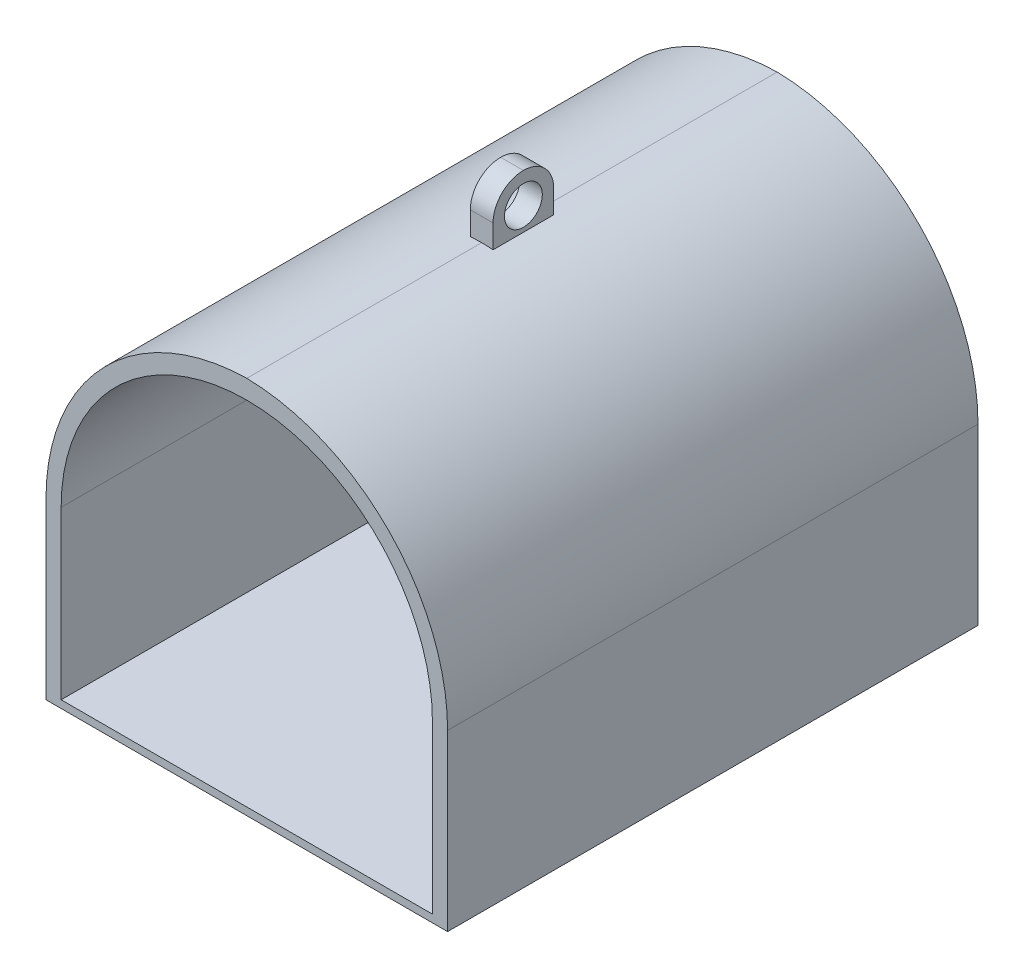
from build123d import *

# Parameters (mm, degrees)
ESQUISSE1_W             = 53
ESQUISSE1_H             = 50
BOSS_EXTRU_1_DEPTH      = 70
ESQUISSE5_W             = 3
ESQUISSE5_H             = 8
BOSS_EXTRU_2_DEPTH      = 7
CONG_1_R                = 4
CONG_2_R                = 27
ESQUISSE8_R             = 2.5
ENL_V_MAT_EXTRU_3_DEPTH = 7
ENL_V_MAT_EXTRU_4_DEPTH = 68


# Some blends are built 0.0001 mm under size
with BuildPart() as part:
    # Esquisse1 → Boss.-Extru.1 (new body)
    with BuildSketch(Plane.XY):
        with Locations((26.5, 25)):
            Rectangle(ESQUISSE1_W, ESQUISSE1_H)
    extrude(amount=BOSS_EXTRU_1_DEPTH)

    # Esquisse5 → Boss.-Extru.2 (add)
    with BuildSketch(Plane(origin=(0, 50, 0), x_dir=(1, 0, 0), z_dir=(0, 1, 0))):
        with Locations((26.5, -35)):
            Rectangle(ESQUISSE5_W, ESQUISSE5_H)
    extrude(amount=BOSS_EXTRU_2_DEPTH)

    # Congé1
    cong_1_edges = [part.edges().sort_by_distance(p)[0] for p in [
        (26.5, 57, 31),
        (26.5, 57, 39),
    ]]
    fillet(cong_1_edges, radius=CONG_1_R - 0.0001)  # a hair under: the kernel refuses the full size

    # Congé2
    # the kernel refuses this fillet: 27 mm, written as the material it takes off along each edge
    with BuildSketch(Plane(origin=(0, 50, -67.5), x_dir=(1, 0, 0), z_dir=(0, 0, 1))) as cong_2_piece_1_section:
        with BuildLine():
            CenterArc((CONG_2_R, -CONG_2_R), CONG_2_R, 90, 90)
            Line((0, -CONG_2_R), (0, 0))
            Line((0, 0), (CONG_2_R, 0))
        make_face()
    cong_2_piece_1 = extrude(amount=205, mode=Mode.PRIVATE)
    cong_2_piece_1 = split(cong_2_piece_1, bisect_by=Plane(origin=(25, 50.257211281, -18.25), z_dir=(1, 0, 0)), keep=Keep.TOP, mode=Mode.PRIVATE)
    cong_2_piece_1 = split(cong_2_piece_1, bisect_by=Plane(origin=(25.978114042, 50.257211281, 31), z_dir=(0, 0, -1)), keep=Keep.TOP, mode=Mode.PRIVATE)
    add(cong_2_piece_1, mode=Mode.SUBTRACT)
    with BuildSketch(Plane(origin=(0, 50, -67.5), x_dir=(1, 0, 0), z_dir=(0, 0, 1))) as cong_2_piece_2_section:
        with BuildLine():
            CenterArc((CONG_2_R, -CONG_2_R), CONG_2_R, 90, 90)
            Line((0, -CONG_2_R), (0, 0))
            Line((0, 0), (CONG_2_R, 0))
        make_face()
    cong_2_piece_2 = extrude(amount=205, mode=Mode.PRIVATE)
    cong_2_piece_2 = split(cong_2_piece_2, bisect_by=Plane(origin=(25, 43.848394797, -18.25), z_dir=(-1, 0, 0)), keep=Keep.TOP, mode=Mode.PRIVATE)
    cong_2_piece_2 = split(cong_2_piece_2, bisect_by=Plane(origin=(5.991236712, 43.848394797, 31), z_dir=(0, 0, -1)), keep=Keep.TOP, mode=Mode.PRIVATE)
    add(cong_2_piece_2, mode=Mode.SUBTRACT)
    with BuildSketch(Plane(origin=(0, 50, -67.5), x_dir=(1, 0, 0), z_dir=(0, 0, 1))) as cong_2_piece_3_section:
        with BuildLine():
            CenterArc((CONG_2_R, -CONG_2_R), CONG_2_R, 90, 90)
            Line((0, -CONG_2_R), (0, 0))
            Line((0, 0), (CONG_2_R, 0))
        make_face()
    cong_2_piece_3 = extrude(amount=205, mode=Mode.PRIVATE)
    cong_2_piece_3 = split(cong_2_piece_3, bisect_by=Plane(origin=(25, 43.848394797, 35), z_dir=(-1, 0, 0)), keep=Keep.TOP, mode=Mode.PRIVATE)
    cong_2_piece_3 = split(cong_2_piece_3, bisect_by=Plane(origin=(5.991236712, 43.848394797, 31), z_dir=(0, 0, 1)), keep=Keep.TOP, mode=Mode.PRIVATE)
    cong_2_piece_3 = split(cong_2_piece_3, bisect_by=Plane(origin=(5.991236712, 43.848394797, 39), z_dir=(0, 0, -1)), keep=Keep.TOP, mode=Mode.PRIVATE)
    add(cong_2_piece_3, mode=Mode.SUBTRACT)
    with BuildSketch(Plane(origin=(0, 50, -67.5), x_dir=(1, 0, 0), z_dir=(0, 0, 1))) as cong_2_piece_4_section:
        with BuildLine():
            CenterArc((CONG_2_R, -CONG_2_R), CONG_2_R, 90, 90)
            Line((0, -CONG_2_R), (0, 0))
            Line((0, 0), (CONG_2_R, 0))
        make_face()
    cong_2_piece_4 = extrude(amount=205, mode=Mode.PRIVATE)
    cong_2_piece_4 = split(cong_2_piece_4, bisect_by=Plane(origin=(25, 50.257211281, 88.25), z_dir=(1, 0, 0)), keep=Keep.TOP, mode=Mode.PRIVATE)
    cong_2_piece_4 = split(cong_2_piece_4, bisect_by=Plane(origin=(25.978114042, 50.257211281, 39), z_dir=(0, 0, 1)), keep=Keep.TOP, mode=Mode.PRIVATE)
    add(cong_2_piece_4, mode=Mode.SUBTRACT)
    with BuildSketch(Plane(origin=(0, 50, -67.5), x_dir=(1, 0, 0), z_dir=(0, 0, 1))) as cong_2_piece_5_section:
        with BuildLine():
            CenterArc((CONG_2_R, -CONG_2_R), CONG_2_R, 90, 90)
            Line((0, -CONG_2_R), (0, 0))
            Line((0, 0), (CONG_2_R, 0))
        make_face()
    cong_2_piece_5 = extrude(amount=205, mode=Mode.PRIVATE)
    cong_2_piece_5 = split(cong_2_piece_5, bisect_by=Plane(origin=(25, 43.848394797, 88.25), z_dir=(-1, 0, 0)), keep=Keep.TOP, mode=Mode.PRIVATE)
    cong_2_piece_5 = split(cong_2_piece_5, bisect_by=Plane(origin=(5.991236712, 43.848394797, 39), z_dir=(0, 0, 1)), keep=Keep.TOP, mode=Mode.PRIVATE)
    add(cong_2_piece_5, mode=Mode.SUBTRACT)
    with BuildSketch(Plane(origin=(53, 50, -67.5), x_dir=(-1, 0, 0), z_dir=(0, 0, 1))) as cong_2_piece_6_section:
        with BuildLine():
            CenterArc((CONG_2_R, CONG_2_R), CONG_2_R, 180, 90)
            Line((0, CONG_2_R), (0, 0))
            Line((0, 0), (CONG_2_R, 0))
        make_face()
    cong_2_piece_6 = extrude(amount=205, mode=Mode.PRIVATE)
    cong_2_piece_6 = split(cong_2_piece_6, bisect_by=Plane(origin=(27.021885958, 50.257211281, 31), z_dir=(0, 0, -1)), keep=Keep.TOP, mode=Mode.PRIVATE)
    cong_2_piece_6 = split(cong_2_piece_6, bisect_by=Plane(origin=(28, 50.257211281, -18.25), z_dir=(-1, 0, 0)), keep=Keep.TOP, mode=Mode.PRIVATE)
    add(cong_2_piece_6, mode=Mode.SUBTRACT)
    with BuildSketch(Plane(origin=(53, 50, -67.5), x_dir=(-1, 0, 0), z_dir=(0, 0, 1))) as cong_2_piece_7_section:
        with BuildLine():
            CenterArc((CONG_2_R, CONG_2_R), CONG_2_R, 180, 90)
            Line((0, CONG_2_R), (0, 0))
            Line((0, 0), (CONG_2_R, 0))
        make_face()
    cong_2_piece_7 = extrude(amount=205, mode=Mode.PRIVATE)
    cong_2_piece_7 = split(cong_2_piece_7, bisect_by=Plane(origin=(47.008763288, 43.848394797, 31), z_dir=(0, 0, -1)), keep=Keep.TOP, mode=Mode.PRIVATE)
    cong_2_piece_7 = split(cong_2_piece_7, bisect_by=Plane(origin=(28, 43.848394797, -18.25), z_dir=(1, 0, 0)), keep=Keep.TOP, mode=Mode.PRIVATE)
    add(cong_2_piece_7, mode=Mode.SUBTRACT)
    with BuildSketch(Plane(origin=(53, 50, -67.5), x_dir=(-1, 0, 0), z_dir=(0, 0, 1))) as cong_2_piece_8_section:
        with BuildLine():
            CenterArc((CONG_2_R, CONG_2_R), CONG_2_R, 180, 90)
            Line((0, CONG_2_R), (0, 0))
            Line((0, 0), (CONG_2_R, 0))
        make_face()
    cong_2_piece_8 = extrude(amount=205, mode=Mode.PRIVATE)
    cong_2_piece_8 = split(cong_2_piece_8, bisect_by=Plane(origin=(47.008763288, 43.848394797, 31), z_dir=(0, 0, 1)), keep=Keep.TOP, mode=Mode.PRIVATE)
    cong_2_piece_8 = split(cong_2_piece_8, bisect_by=Plane(origin=(28, 43.848394797, 35), z_dir=(1, 0, 0)), keep=Keep.TOP, mode=Mode.PRIVATE)
    cong_2_piece_8 = split(cong_2_piece_8, bisect_by=Plane(origin=(47.008763288, 43.848394797, 39), z_dir=(0, 0, -1)), keep=Keep.TOP, mode=Mode.PRIVATE)
    add(cong_2_piece_8, mode=Mode.SUBTRACT)
    with BuildSketch(Plane(origin=(53, 50, -67.5), x_dir=(-1, 0, 0), z_dir=(0, 0, 1))) as cong_2_piece_9_section:
        with BuildLine():
            CenterArc((CONG_2_R, CONG_2_R), CONG_2_R, 180, 90)
            Line((0, CONG_2_R), (0, 0))
            Line((0, 0), (CONG_2_R, 0))
        make_face()
    cong_2_piece_9 = extrude(amount=205, mode=Mode.PRIVATE)
    cong_2_piece_9 = split(cong_2_piece_9, bisect_by=Plane(origin=(28, 50.257211281, 88.25), z_dir=(-1, 0, 0)), keep=Keep.TOP, mode=Mode.PRIVATE)
    cong_2_piece_9 = split(cong_2_piece_9, bisect_by=Plane(origin=(27.021885958, 50.257211281, 39), z_dir=(0, 0, 1)), keep=Keep.TOP, mode=Mode.PRIVATE)
    add(cong_2_piece_9, mode=Mode.SUBTRACT)
    with BuildSketch(Plane(origin=(53, 50, -67.5), x_dir=(-1, 0, 0), z_dir=(0, 0, 1))) as cong_2_piece_10_section:
        with BuildLine():
            CenterArc((CONG_2_R, CONG_2_R), CONG_2_R, 180, 90)
            Line((0, CONG_2_R), (0, 0))
            Line((0, 0), (CONG_2_R, 0))
        make_face()
    cong_2_piece_10 = extrude(amount=205, mode=Mode.PRIVATE)
    cong_2_piece_10 = split(cong_2_piece_10, bisect_by=Plane(origin=(28, 43.848394797, 88.25), z_dir=(1, 0, 0)), keep=Keep.TOP, mode=Mode.PRIVATE)
    cong_2_piece_10 = split(cong_2_piece_10, bisect_by=Plane(origin=(47.008763288, 43.848394797, 39), z_dir=(0, 0, 1)), keep=Keep.TOP, mode=Mode.PRIVATE)
    add(cong_2_piece_10, mode=Mode.SUBTRACT)

    # Esquisse8 → Enlèv. mat.-Extru.3 (cut)
    with BuildSketch(Plane.ZY.offset(-25)):
        with Locations((35, 53)):
            Circle(ESQUISSE8_R)
    extrude(amount=-ENL_V_MAT_EXTRU_3_DEPTH, mode=Mode.SUBTRACT)

    # Esquisse9 → Enlèv. mat.-Extru.4 (cut)
    with BuildSketch(Plane.XY.offset(70)):
        with BuildLine():
            Line((2, 1), (51, 1))
            Line((51, 1), (51, 23))
            ThreePointArc((51, 23), (43.829843545, 40.318386839), (26.516202227, 47.499994643))
            ThreePointArc((26.516202227, 47.499994643), (9.181613161, 40.329843545), (2, 23))
            Line((2, 23), (2, 1))
        make_face()
    extrude(amount=-ENL_V_MAT_EXTRU_4_DEPTH, mode=Mode.SUBTRACT)


solid = part.part
